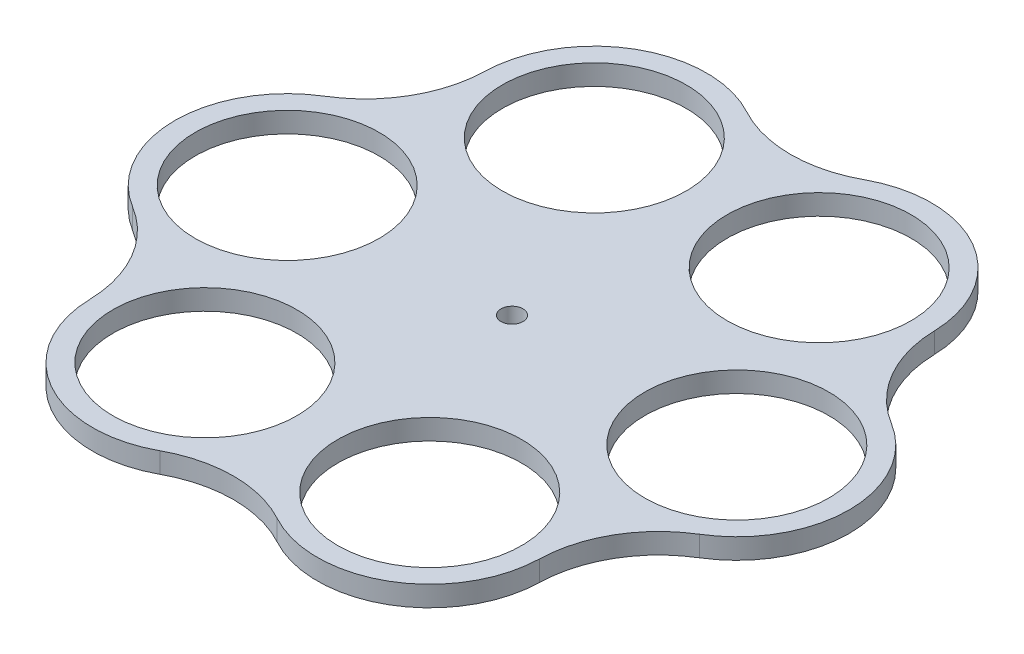
from build123d import *

# Parameters (mm, degrees)
SKETCH1_R           = 22.5
SKETCH1_R_2         = 2.7
BOSS_EXTRUDE1_DEPTH = 5


with BuildPart() as part:
    # Sketch1 → Boss-Extrude1 (new body)
    with BuildSketch(Plane(origin=(0, 0, 0), x_dir=(1, 0, 0), z_dir=(0, 1, 0))):
        with BuildLine():
            ThreePointArc((69.339283971, 23.465611759), (59.001377098, 34.06446095), (54.991457884, 48.316775519))
            ThreePointArc((54.991457884, 48.316775519), (41.25, 71.447095812), (14.347826087, 71.782387278))
            ThreePointArc((14.347826087, 71.782387278), (0, 68.1289219), (-14.347826087, 71.782387278))
            ThreePointArc((-14.347826087, 71.782387278), (-41.25, 71.447095812), (-54.991457884, 48.316775519))
            ThreePointArc((-54.991457884, 48.316775519), (-59.001377098, 34.06446095), (-69.339283971, 23.465611759))
            ThreePointArc((-69.339283971, 23.465611759), (-82.5, 0), (-69.339283971, -23.465611759))
            ThreePointArc((-69.339283971, -23.465611759), (-59.001377098, -34.06446095), (-54.991457884, -48.316775519))
            ThreePointArc((-54.991457884, -48.316775519), (-41.25, -71.447095812), (-14.347826087, -71.782387278))
            ThreePointArc((-14.347826087, -71.782387278), (0, -68.1289219), (14.347826087, -71.782387278))
            ThreePointArc((14.347826087, -71.782387278), (41.25, -71.447095812), (54.991457884, -48.316775519))
            ThreePointArc((54.991457884, -48.316775519), (59.001377098, -34.06446095), (69.339283971, -23.465611759))
            ThreePointArc((69.339283971, -23.465611759), (82.5, 0), (69.339283971, 23.465611759))
        make_face()
        with Locations((-27.5, -47.631397208)):
            Circle(SKETCH1_R, mode=Mode.SUBTRACT)
        with Locations((-55, 0)):
            Circle(SKETCH1_R, mode=Mode.SUBTRACT)
        with Locations((27.5, -47.631397208)):
            Circle(SKETCH1_R, mode=Mode.SUBTRACT)
        Circle(SKETCH1_R_2, mode=Mode.SUBTRACT)
        with Locations((55, 0)):
            Circle(SKETCH1_R, mode=Mode.SUBTRACT)
        with Locations((-27.5, 47.631397208)):
            Circle(SKETCH1_R, mode=Mode.SUBTRACT)
        with Locations((27.5, 47.631397208)):
            Circle(SKETCH1_R, mode=Mode.SUBTRACT)
    extrude(amount=BOSS_EXTRUDE1_DEPTH)


solid = part.part
